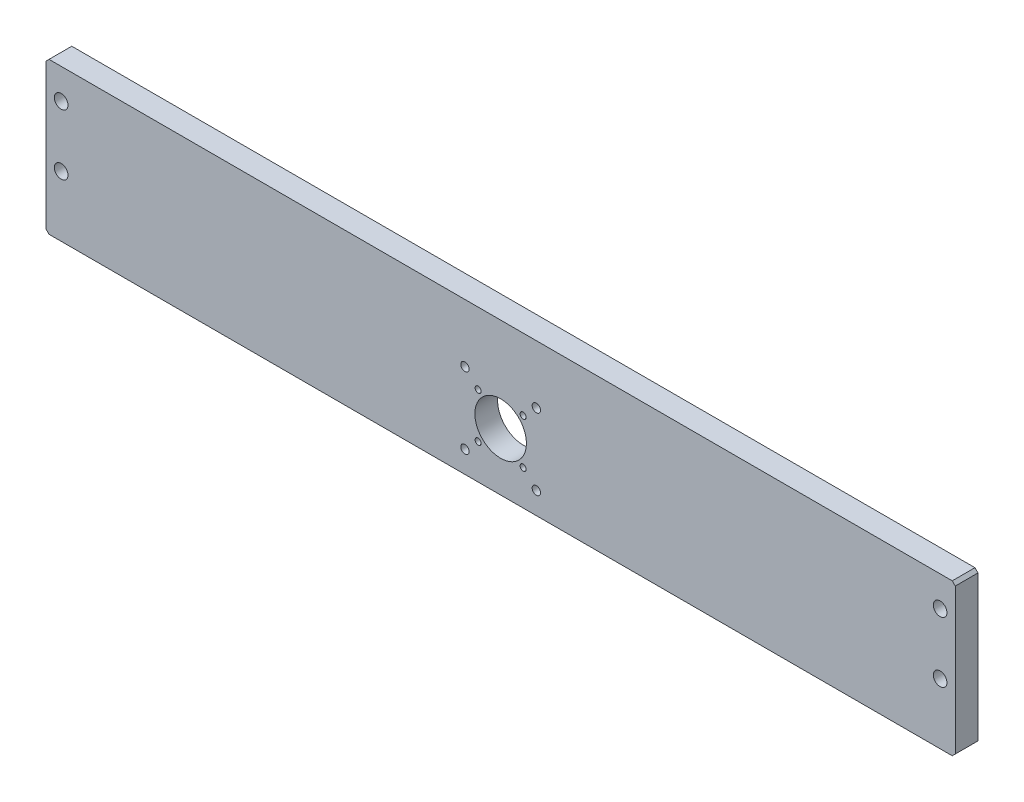
from build123d import *

# Parameters (mm, degrees)
SCHIZZO1_R                                          = 17
SCHIZZO1_R_2                                        = 2
BOSS_EXTRUDE1_DEPTH                                 = 15
M8_TAPPED_HOLE1_D                                   = 6.8
M8_TAPPED_HOLE1_DEPTH                               = 23.75
M8_TAPPED_HOLE1_TIP                                 = 2.042926105
CBORE_FOR_M8_HEX_SOCKET_HEAD_CAP_SCREW1_D           = 9
CBORE_FOR_M8_HEX_SOCKET_HEAD_CAP_SCREW1_DEPTH       = 25.75
CBORE_FOR_M8_HEX_SOCKET_HEAD_CAP_SCREW1_CBORE_D     = 15
CBORE_FOR_M8_HEX_SOCKET_HEAD_CAP_SCREW1_CBORE_DEPTH = 8.6
M5_CLEARANCE_HOLE1_D                                = 5.5
M5_CLEARANCE_HOLE1_DEPTH                            = 35
M5_CLEARANCE_HOLE1_TIP                              = 1.652366702


with BuildPart() as part:
    # Schizzo1 → Boss-Extrude1 (new body)
    with BuildSketch(Plane.XY):
        Polygon((2, 0), (598, 0), (600, 2), (600, 98), (598, 100), (2, 100), (0, 98), (0, 2), align=None)
        with Locations((300, 38)):
            Circle(SCHIZZO1_R, mode=Mode.SUBTRACT)
        with Locations((314.849242405, 52.849242405)):
            Circle(SCHIZZO1_R_2, mode=Mode.SUBTRACT)
        with Locations((314.849242405, 23.150757595)):
            Circle(SCHIZZO1_R_2, mode=Mode.SUBTRACT)
        with Locations((285.150757595, 23.150757595)):
            Circle(SCHIZZO1_R_2, mode=Mode.SUBTRACT)
        with Locations((285.150757595, 52.849242405)):
            Circle(SCHIZZO1_R_2, mode=Mode.SUBTRACT)
    extrude(amount=-BOSS_EXTRUDE1_DEPTH)

    # M8 Tapped Hole1
    with Locations(Plane(origin=(30, 0, -7.5), x_dir=(0, 0, -1), z_dir=(0, -1, 0))):
        with Locations((0, 0), (0, 540)):
            Hole(M8_TAPPED_HOLE1_D / 2, depth=M8_TAPPED_HOLE1_DEPTH)
            with Locations((0, 0, -(M8_TAPPED_HOLE1_DEPTH + M8_TAPPED_HOLE1_TIP / 2))):  # 118° drill point
                Cone(0, M8_TAPPED_HOLE1_D / 2, M8_TAPPED_HOLE1_TIP, mode=Mode.SUBTRACT)

    # CBORE for M8 Hex Socket Head Cap Screw1
    with Locations(Plane(origin=(590, 80, -15), x_dir=(-1, 0, 0), z_dir=(0, 0, -1))):
        with Locations((0, 0), (0, -40), (580, 0), (580, -40)):
            CounterBoreHole(CBORE_FOR_M8_HEX_SOCKET_HEAD_CAP_SCREW1_D / 2, CBORE_FOR_M8_HEX_SOCKET_HEAD_CAP_SCREW1_CBORE_D / 2, CBORE_FOR_M8_HEX_SOCKET_HEAD_CAP_SCREW1_CBORE_DEPTH, depth=CBORE_FOR_M8_HEX_SOCKET_HEAD_CAP_SCREW1_DEPTH)

    # M5 Clearance Hole1
    with Locations(Plane.XY):
        with Locations((276.43, 61.57), (323.57, 61.57), (323.57, 14.43), (276.43, 14.43)):
            Hole(M5_CLEARANCE_HOLE1_D / 2, depth=M5_CLEARANCE_HOLE1_DEPTH)
            with Locations((0, 0, -(M5_CLEARANCE_HOLE1_DEPTH + M5_CLEARANCE_HOLE1_TIP / 2))):  # 118° drill point
                Cone(0, M5_CLEARANCE_HOLE1_D / 2, M5_CLEARANCE_HOLE1_TIP, mode=Mode.SUBTRACT)


solid = part.part
